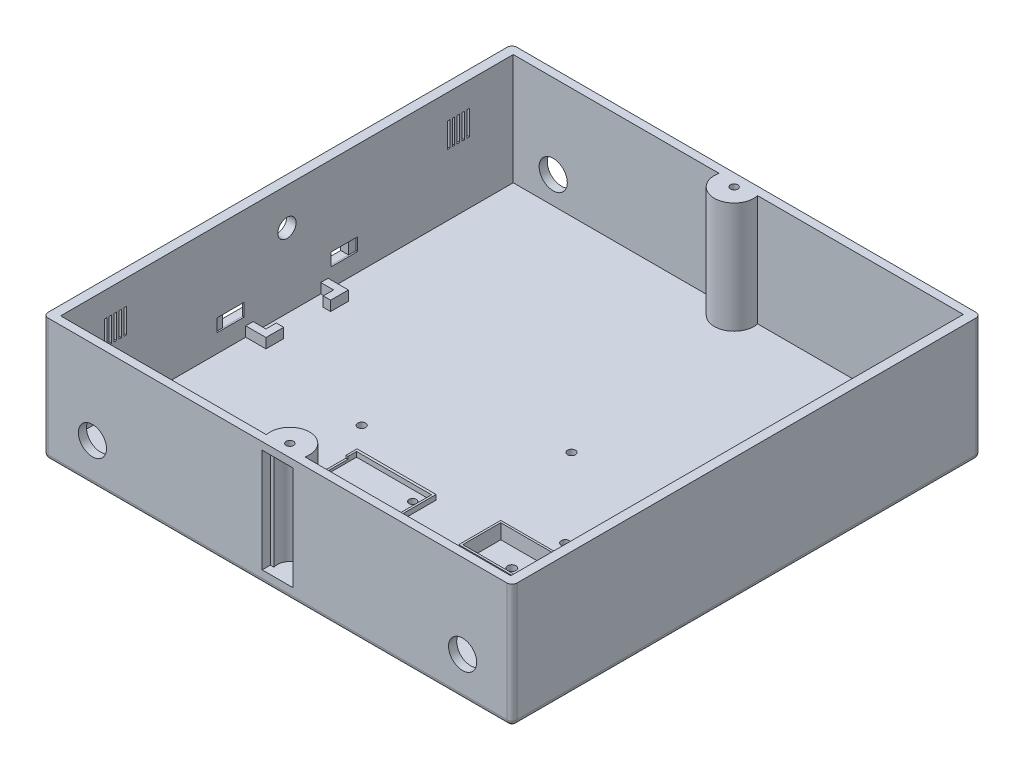
from build123d import *

# Parameters (mm, degrees)
SKETCH2_W            = 190
SKETCH2_H            = 190
BOSS_EXTRUDE1_DEPTH  = 5
SKETCH4_W            = 6
SKETCH4_H            = 6
BOSS_EXTRUDE2_DEPTH  = 3
SKETCH7_R            = 2.799999999
BOSS_EXTRUDE5_DEPTH  = 6
BOSS_EXTRUDE10_DEPTH = 45
BOSS_EXTRUDE6_DEPTH  = 6
BOSS_EXTRUDE7_DEPTH  = 6
CUT_EXTRUDE6_DEPTH   = 6
BOSS_EXTRUDE8_DEPTH  = 6
SKETCH15_R           = 1.7
CUT_EXTRUDE7_DEPTH   = 25
SKETCH16_W           = 32
SKETCH16_H           = 24
SKETCH16_W_2         = 30.4
SKETCH16_H_2         = 22.171363073
BOSS_EXTRUDE9_DEPTH  = 2
SKETCH17_W           = 15
SKETCH17_H           = 1
CUT_EXTRUDE8_DEPTH   = 1.2
SKETCH18_R           = 1.5
CUT_EXTRUDE9_DEPTH   = 12
CUT_EXTRUDE11_DEPTH  = 15
SKETCH22_R           = 5.7
CUT_EXTRUDE12_DEPTH  = 15
SKETCH23_R           = 5.7
CUT_EXTRUDE13_DEPTH  = 15
SKETCH26_R           = 3.7
CUT_EXTRUDE14_DEPTH  = 15
BOSS_EXTRUDE13_DEPTH = 4
SKETCH39_R           = 8
SKETCH39_R_2         = 1.5
BOSS_EXTRUDE21_DEPTH = 45
CUT_EXTRUDE43_DEPTH  = 42
CUT_EXTRUDE47_DEPTH  = 42
SKETCH45_R           = 8
SKETCH45_R_2         = 1.5
BOSS_EXTRUDE22_DEPTH = 45
CUT_EXTRUDE48_DEPTH  = 42
CUT_EXTRUDE49_DEPTH  = 42
BOSS_EXTRUDE23_DEPTH = 45
SKETCH49_R           = 1.00126639
SKETCH49_R_2         = 1
CUT_EXTRUDE50_DEPTH  = 45
FILLET2_R            = 2
SKETCH51_R           = 1.608
CUT_EXTRUDE51_DEPTH  = 45
SKETCH52_W           = 1
SKETCH52_H           = 10
CUT_EXTRUDE53_DEPTH  = 45
SKETCH53_W           = 51.2
SKETCH53_H           = 5.2
CUT_EXTRUDE54_DEPTH  = 3.2
SKETCH55_W           = 7.803577565
SKETCH55_H           = 5.19826713
SKETCH55_W_2         = 8
CUT_EXTRUDE55_DEPTH  = 3.2
SKETCH56_W           = 3
SKETCH56_H           = 5.19826713
CUT_EXTRUDE56_DEPTH  = 0.6
CUT_EXTRUDE57_START  = -5
CUT_EXTRUDE57_DEPTH  = 5


with BuildPart() as part:
    # Sketch2 → Boss-Extrude1 (new body)
    with BuildSketch(Plane(origin=(0, 0, 0), x_dir=(1, 0, 0), z_dir=(0, 1, 0))):
        with Locations((317.995760734, 126.549729936)):
            Rectangle(SKETCH2_W, SKETCH2_H)
    extrude(amount=BOSS_EXTRUDE1_DEPTH)

    # Sketch4 → Boss-Extrude2 (add)
    with BuildSketch(Plane(origin=(0, 5, 0), x_dir=(1, 0, 0), z_dir=(0, 1, 0))):
        with Locations((383.22341631, 141.294689712)):
            Rectangle(SKETCH4_W, SKETCH4_H)
        with Locations((397.22341631, 141.294689712)):
            Rectangle(SKETCH4_W, SKETCH4_H)
        with Locations((383.22341631, 175.294689712)):
            Rectangle(SKETCH4_W, SKETCH4_H)
        with Locations((397.22341631, 175.294689712)):
            Rectangle(SKETCH4_W, SKETCH4_H)
    extrude(amount=BOSS_EXTRUDE2_DEPTH)

    # Sketch7 → Boss-Extrude5 (add)
    with BuildSketch(Plane(origin=(0, 5, 0), x_dir=(1, 0, 0), z_dir=(0, 1, 0))):
        with BuildLine():
            Line((401.22341631, 137.294689712), (401.22341631, 146.003401864))
            ThreePointArc((401.22341631, 146.003401864), (402.72341631, 148.294689712), (401.22341631, 150.585977559))
            Line((401.22341631, 150.585977559), (401.22341631, 165.466262588))
            ThreePointArc((401.22341631, 165.466262588), (400.829054735, 165.356458596), (400.42341631, 165.301363803))
            Line((400.42341631, 165.301363803), (400.42341631, 149.982884013))
            ThreePointArc((400.42341631, 149.982884013), (401.92341631, 148.294689711), (400.42341631, 146.60649541))
            Line((400.42341631, 146.60649541), (400.42341631, 138.094689712))
            Line((400.42341631, 138.094689712), (380.02341631, 138.094689712))
            Line((380.02341631, 138.094689712), (380.02341631, 146.60649541))
            ThreePointArc((380.02341631, 146.60649541), (378.52341631, 148.294689711), (380.023416309, 149.982884013))
            Line((380.023416309, 149.982884013), (380.023416309, 165.301363803))
            ThreePointArc((380.023416309, 165.301363801), (379.617777883, 165.356458594), (379.223416309, 165.466262586))
            Line((379.22341631, 165.466262588), (379.22341631, 150.585977559))
            ThreePointArc((379.22341631, 150.585977559), (377.72341631, 148.294689712), (379.22341631, 146.003401864))
            Line((379.22341631, 146.003401864), (379.22341631, 137.294689712))
            Line((379.22341631, 137.294689712), (401.22341631, 137.294689712))
        make_face()
        with Locations((380.223416309, 168.294689712)):
            Circle(SKETCH7_R)
        with BuildLine():
            ThreePointArc((379.223416309, 171.123116838), (379.617777883, 171.23292083), (380.023416309, 171.288015622))
            Line((380.023416309, 171.28801562), (380.023416309, 178.494689712))
            Line((380.023416309, 178.494689712), (388.535222008, 178.494689712))
            ThreePointArc((388.535222008, 178.494689712), (390.22341631, 179.994689712), (391.911610611, 178.494689712))
            Line((391.911610611, 178.494689712), (400.42341631, 178.494689712))
            Line((400.42341631, 178.494689712), (400.42341631, 171.28801562))
            ThreePointArc((400.42341631, 171.28801562), (400.829054735, 171.232920828), (401.22341631, 171.123116836))
            Line((401.22341631, 171.123116836), (401.22341631, 179.294689712))
            Line((401.22341631, 179.294689712), (392.514704157, 179.294689712))
            ThreePointArc((392.514704157, 179.294689712), (390.22341631, 180.794689712), (387.932128462, 179.294689712))
            Line((387.932128462, 179.294689712), (379.22341631, 179.294689712))
            Line((379.22341631, 179.294689712), (379.22341631, 171.123116836))
        make_face()
        with Locations((400.223416311, 168.294689712)):
            Circle(SKETCH7_R)
    extrude(amount=BOSS_EXTRUDE5_DEPTH)

    # Sketch20 → Boss-Extrude10 (add)
    with BuildSketch(Plane(origin=(0, 5, 0), x_dir=(1, 0, 0), z_dir=(0, 1, 0))):
        with BuildLine():
            Line((222.995760734, 31.549729936), (412.995760734, 31.549729936))
            Line((412.995760734, 31.549729936), (412.995760736, 120.304731936))
            ThreePointArc((412.995760735, 120.304731937), (411.205532023, 119.221881119), (409.195760736, 118.640241963))
            Line((409.195760736, 118.640241963), (409.195760736, 34.849729938))
            Line((409.195760736, 34.849729938), (226.795760733, 34.849729938))
            Line((226.795760733, 34.849729938), (226.795760733, 118.640241963))
            Line((226.795760733, 118.640241963), (226.795760733, 134.459217909))
            Line((226.795760733, 134.459217909), (226.795760733, 218.249729938))
            Line((226.795760733, 218.249729938), (409.189482406, 218.249729938))
            Line((409.189482406, 218.249729938), (409.189482406, 134.460167887))
            ThreePointArc((409.189482406, 134.460167887), (411.202623624, 133.878852013), (412.995760734, 132.794727937))
            Line((412.995760734, 132.794727937), (412.995760734, 221.549729936))
            Line((412.995760734, 221.549729936), (222.995760734, 221.549729936))
            Line((222.995760734, 221.549729936), (222.995760733, 132.794727937))
            Line((222.995760734, 132.794727937), (222.995760734, 120.304731936))
            Line((222.995760733, 120.304731936), (222.995760734, 31.549729936))
        make_face()
    extrude(amount=BOSS_EXTRUDE10_DEPTH)

    # Sketch10 → Boss-Extrude6 (add)
    with BuildSketch(Plane(origin=(0, 5, 0), x_dir=(1, 0, 0), z_dir=(0, 1, 0))):
        Polygon((400.42341631, 171.28801562), (400.42341631, 165.301363803), (401.22341631, 165.301363803), (401.22341631, 171.337887446), (400.42341631, 171.337887446), align=None)
    extrude(amount=BOSS_EXTRUDE6_DEPTH)

    # Sketch11 → Boss-Extrude7 (add)
    with BuildSketch(Plane(origin=(0, 5, 0), x_dir=(1, 0, 0), z_dir=(0, 1, 0))):
        Polygon((379.22341631, 171.123116836), (379.22341631, 165.091930174), (380.023416309, 165.091930174), (380.023416309, 171.603611758), (379.22341631, 171.603611758), align=None)
    extrude(amount=BOSS_EXTRUDE7_DEPTH)

    # Sketch13 → Cut-Extrude6 (cut)
    with BuildSketch(Plane(origin=(0, 5, 0), x_dir=(1, 0, 0), z_dir=(0, 1, 0))):
        with BuildLine():
            Line((379.22341631, 165.679350346), (379.22341631, 170.910029077))
            ThreePointArc((379.22341631, 170.910029077), (377.42341631, 168.294689712), (379.22341631, 165.679350346))
        make_face()
    extrude(amount=CUT_EXTRUDE6_DEPTH, mode=Mode.SUBTRACT)

    # Sketch14 → Boss-Extrude8 (add)
    with BuildSketch(Plane(origin=(0, 5, 0), x_dir=(1, 0, 0), z_dir=(0, 1, 0))):
        with BuildLine():
            Line((348.748945699, 90.441877285), (348.748945699, 74.241877285))
            Line((348.748945699, 74.241877285), (383.07719417, 74.241877285))
            ThreePointArc((383.07719417, 74.241877285), (400.548884842, 82.723130909), (383.095443972, 91.241877285))
            Line((383.095443972, 91.241877285), (348.748945699, 91.241877285))
            Line((348.748945699, 91.241877285), (348.748945699, 90.441877285))
        make_face()
        with BuildLine():
            Line((349.548945699, 75.041877285), (349.548945699, 90.441877285))
            Line((349.548945699, 90.441877285), (383.067588644, 90.441877285))
            ThreePointArc((383.067588644, 90.441877285), (399.948885235, 82.723819155), (383.051123105, 75.041877285))
            Line((383.051123105, 75.041877285), (349.548945699, 75.041877285))
        make_face(mode=Mode.SUBTRACT)
    extrude(amount=BOSS_EXTRUDE8_DEPTH)

    # Sketch15 → Cut-Extrude7 (cut)
    with BuildSketch(Plane(origin=(0, 5, 0), x_dir=(1, 0, 0), z_dir=(0, 1, 0))):
        with Locations((361.748945699, 82.734724895)):
            Circle(SKETCH15_R)
    extrude(amount=-CUT_EXTRUDE7_DEPTH, mode=Mode.SUBTRACT)

    # Sketch16 → Boss-Extrude9 (add)
    with BuildSketch(Plane(origin=(0, 5, 0), x_dir=(1, 0, 0), z_dir=(0, 1, 0))):
        with Locations((306.534634956, 79.241877285)):
            Rectangle(SKETCH16_W, SKETCH16_H)
        with Locations((306.534634956, 79.127558822)):
            Rectangle(SKETCH16_W_2, SKETCH16_H_2, mode=Mode.SUBTRACT)
    extrude(amount=BOSS_EXTRUDE9_DEPTH)

    # Sketch17 → Cut-Extrude8 (cut)
    with BuildSketch(Plane.ZY.offset(-290.534634956)):
        with Locations((-79.241877285, 6.5)):
            Rectangle(SKETCH17_W, SKETCH17_H)
    extrude(amount=-CUT_EXTRUDE8_DEPTH, mode=Mode.SUBTRACT)

    # Sketch18 → Cut-Extrude9 (cut)
    with BuildSketch(Plane(origin=(0, 5, 0), x_dir=(1, 0, 0), z_dir=(0, 1, 0))):
        with Locations((318.237299978, 71.546782116)):
            Circle(SKETCH18_R)
        with Locations((318.237299978, 86.021279159)):
            Circle(SKETCH18_R)
    extrude(amount=-CUT_EXTRUDE9_DEPTH, mode=Mode.SUBTRACT)

    # Sketch21 → Cut-Extrude11 (cut)
    with BuildSketch(Plane(origin=(0, 5, 0), x_dir=(1, 0, 0), z_dir=(0, 1, 0))):
        with BuildLine():
            ThreePointArc((401.22341631, 165.679350346), (403.02341631, 168.294689712), (401.22341631, 170.910029077))
            Line((401.22341631, 170.910029077), (401.22341631, 165.679350346))
        make_face()
    extrude(amount=CUT_EXTRUDE11_DEPTH, mode=Mode.SUBTRACT)

    # Sketch22 → Cut-Extrude12 (cut)
    with BuildSketch(Plane(origin=(0, 0, -221.549729936), x_dir=(-1, 0, 0), z_dir=(0, 0, -1))):
        with Locations((-242.995760734, 15.970492544)):
            Circle(SKETCH22_R)
        with Locations((-392.995760734, 15.970492544)):
            Circle(SKETCH22_R)
    extrude(amount=-CUT_EXTRUDE12_DEPTH, mode=Mode.SUBTRACT)

    # Sketch23 → Cut-Extrude13 (cut)
    with BuildSketch(Plane.XY.offset(-31.549729936)):
        with Locations((392.987274742, 15.972381323)):
            Circle(SKETCH23_R)
        with Locations((242.987274742, 15.972381323)):
            Circle(SKETCH23_R)
    extrude(amount=-CUT_EXTRUDE13_DEPTH, mode=Mode.SUBTRACT)

    # Sketch26 → Cut-Extrude14 (cut)
    with BuildSketch(Plane.ZY.offset(-222.995760734)):
        with Locations((-126.549729936, 35)):
            Circle(SKETCH26_R)
    extrude(amount=-CUT_EXTRUDE14_DEPTH, mode=Mode.SUBTRACT)

    # Sketch24 → Boss-Extrude13 (add)
    with BuildSketch(Plane(origin=(0, 5, 0), x_dir=(1, 0, 0), z_dir=(0, 1, 0))):
        Polygon((226.802039063, 143.247259128), (226.802039063, 140.249729936), (231.995760733, 140.249729936), (231.995760733, 136.049729936), (234.995760733, 136.049729936), (234.995760733, 143.247259128), align=None)
        Polygon((231.995760733, 117.049729936), (231.995760733, 112.849729936), (226.802039063, 112.849729936), (226.802039063, 109.849729936), (234.995760733, 109.849729936), (234.995760733, 117.049729936), align=None)
    extrude(amount=BOSS_EXTRUDE13_DEPTH)

    # Sketch39 → Boss-Extrude21 (add)
    with BuildSketch(Plane(origin=(0, 5, 0), x_dir=(1, 0, 0), z_dir=(0, 1, 0))):
        with Locations((317.995760735, 216.549729936)):
            Circle(SKETCH39_R)
        with Locations((317.995760735, 216.549729936)):
            Circle(SKETCH39_R_2, mode=Mode.SUBTRACT)
    extrude(amount=BOSS_EXTRUDE21_DEPTH)

    # Sketch41 → Cut-Extrude43 (cut)
    with BuildSketch(Plane(origin=(0, 5, 0), x_dir=(1, 0, 0), z_dir=(0, 1, 0))):
        with BuildLine():
            ThreePointArc((324.240758735, 221.549729933), (317.995760735, 224.549729936), (311.750762734, 221.549729933))
            Line((311.750762734, 221.549729933), (317.995760735, 221.549729933))
            Line((317.995760735, 221.549729933), (324.240758735, 221.549729933))
        make_face()
    extrude(amount=CUT_EXTRUDE43_DEPTH, mode=Mode.SUBTRACT)

    # Sketch42 → Cut-Extrude47 (cut)
    with BuildSketch(Plane(origin=(0, 5, 0), x_dir=(1, 0, 0), z_dir=(0, 1, 0))):
        with BuildLine():
            Line((311.750762736, 221.549729936), (311.750762736, 218.26387511))
            Line((311.750762736, 218.26387511), (313.298771665, 218.26387511))
            ThreePointArc((313.298771665, 218.26387511), (317.988236008, 211.549735598), (322.697887912, 218.249729938))
            Line((322.697887912, 218.249729938), (324.25546859, 218.249729938))
            Line((324.25546859, 218.249729938), (324.240758733, 221.549729936))
            Line((324.240758733, 221.549729936), (323.695017468, 221.549729936))
            Line((323.695017468, 221.549729936), (311.750762736, 221.549729936))
        make_face()
    extrude(amount=CUT_EXTRUDE47_DEPTH, mode=Mode.SUBTRACT)

    # Sketch45 → Boss-Extrude22 (add)
    with BuildSketch(Plane(origin=(0, 5, 0), x_dir=(1, 0, 0), z_dir=(0, 1, 0))):
        with Locations((317.995760735, 36.549729936)):
            Circle(SKETCH45_R)
        with Locations((317.995760735, 36.549729936)):
            Circle(SKETCH45_R_2, mode=Mode.SUBTRACT)
    extrude(amount=BOSS_EXTRUDE22_DEPTH)

    # Sketch46 → Cut-Extrude48 (cut)
    with BuildSketch(Plane(origin=(0, 5, 0), x_dir=(1, 0, 0), z_dir=(0, 1, 0))):
        with BuildLine():
            Line((324.240758733, 31.549729936), (317.995760735, 31.549729936))
            Line((317.995760735, 31.549729936), (311.750762736, 31.549729936))
            ThreePointArc((311.750762736, 31.549729936), (317.995760735, 28.549729936), (324.240758733, 31.549729936))
        make_face()
    extrude(amount=CUT_EXTRUDE48_DEPTH, mode=Mode.SUBTRACT)

    # Sketch47 → Cut-Extrude49 (cut)
    with BuildSketch(Plane(origin=(0, 5, 0), x_dir=(1, 0, 0), z_dir=(0, 1, 0))):
        with BuildLine():
            Line((313.293633557, 34.849729934), (311.750762734, 34.849729934))
            Line((311.750762734, 34.849729934), (311.750762734, 31.549729939))
            Line((311.750762734, 31.549729939), (317.995760735, 31.549729939))
            Line((317.995760735, 31.549729939), (324.240758735, 31.549729939))
            Line((324.240758735, 31.549729939), (324.240758735, 34.849729934))
            Line((324.240758735, 34.849729934), (322.697887912, 34.849729934))
            ThreePointArc((322.697887912, 34.849729934), (317.995760735, 41.549729936), (313.293633557, 34.849729934))
        make_face()
    extrude(amount=CUT_EXTRUDE49_DEPTH, mode=Mode.SUBTRACT)

    # Sketch48 → Boss-Extrude23 (add)
    with BuildSketch(Plane(origin=(0, 5, 0), x_dir=(1, 0, 0), z_dir=(0, 1, 0))):
        Polygon((409.189482406, 134.460167887), (409.195760736, 118.640241963), (412.995760736, 118.640241963), (412.995760736, 134.460167887), align=None)
    extrude(amount=BOSS_EXTRUDE23_DEPTH)

    # Sketch49 → Cut-Extrude50 (cut)
    with BuildSketch(Plane(origin=(0, 5, 0), x_dir=(1, 0, 0), z_dir=(0, 1, 0))):
        with Locations((400.223416309, 148.294689712)):
            Circle(SKETCH49_R)
        with Locations((380.223416309, 148.294689712)):
            Circle(SKETCH49_R_2)
        with Locations((390.223416309, 178.294689712)):
            Circle(SKETCH49_R_2)
    extrude(amount=-CUT_EXTRUDE50_DEPTH, mode=Mode.SUBTRACT)

    # Fillet2
    fillet2_edges = [part.edges().sort_by_distance(p)[0] for p in [
        (412.995760734, 0, -126.549729936),
        (317.995760734, 0, -31.549729936),
        (222.995760734, 0, -126.549729936),
        (317.995760734, 0, -221.549729936),
        (222.995760734, 27.5, -221.549729936),
        (412.995760734, 25, -221.549729936),
        (412.995760734, 27.5, -31.549729936),
        (222.995760734, 27.5, -31.549729936),
    ]]
    fillet(fillet2_edges, radius=FILLET2_R)

    # Sketch51 → Cut-Extrude51 (cut)
    with BuildSketch(Plane(origin=(0, 5, 0), x_dir=(1, 0, 0), z_dir=(0, 1, 0))):
        with Locations((281.200760735, 102.438729936)):
            Circle(SKETCH51_R)
        with Locations((363.679760735, 102.438729936)):
            Circle(SKETCH51_R)
        with Locations((333.231760735, 135.425729936)):
            Circle(SKETCH51_R)
    extrude(amount=-CUT_EXTRUDE51_DEPTH, mode=Mode.SUBTRACT)

    # Sketch52 → Cut-Extrude53 (cut)
    with BuildSketch(Plane.ZY.offset(-222.995760734)):
        with Locations((-200.049729936, 35)):
            Rectangle(SKETCH52_W, SKETCH52_H)
        with Locations((-198.049729936, 35)):
            Rectangle(SKETCH52_W, SKETCH52_H)
        with Locations((-196.049729936, 35)):
            Rectangle(SKETCH52_W, SKETCH52_H)
        with Locations((-194.049729936, 35)):
            Rectangle(SKETCH52_W, SKETCH52_H)
        with Locations((-192.049729936, 35)):
            Rectangle(SKETCH52_W, SKETCH52_H)
        with Locations((-53.049729936, 35)):
            Rectangle(SKETCH52_W, SKETCH52_H)
        with Locations((-55.049729936, 35)):
            Rectangle(SKETCH52_W, SKETCH52_H)
        with Locations((-57.049729936, 35)):
            Rectangle(SKETCH52_W, SKETCH52_H)
        with Locations((-59.049729936, 35)):
            Rectangle(SKETCH52_W, SKETCH52_H)
        with Locations((-61.049729936, 35)):
            Rectangle(SKETCH52_W, SKETCH52_H)
    extrude(amount=-CUT_EXTRUDE53_DEPTH, mode=Mode.SUBTRACT)

    # Sketch53 → Cut-Extrude54 (cut)
    with BuildSketch(Plane.ZY.offset(-222.995760734)):
        with Locations((-126.549729936, 15)):
            Rectangle(SKETCH53_W, SKETCH53_H)
    extrude(amount=-CUT_EXTRUDE54_DEPTH, mode=Mode.SUBTRACT)

    # Sketch55 → Cut-Extrude55 (cut)
    with BuildSketch(Plane.ZY.offset(-226.195760734)):
        with Locations((-148.247941153, 15.000866435)):
            Rectangle(SKETCH55_W, SKETCH55_H)
        with Locations((-105.146152371, 15.000866435)):
            Rectangle(SKETCH55_W_2, SKETCH55_H)
    extrude(amount=-CUT_EXTRUDE55_DEPTH, mode=Mode.SUBTRACT)

    # Sketch56 → Cut-Extrude56 (cut)
    with BuildSketch(Plane(origin=(226.795760733, 0, 0), x_dir=(0, 0, -1), z_dir=(1, 0, 0))):
        with Locations((99.646152371, 15.000866435)):
            Rectangle(SKETCH56_W, SKETCH56_H)
        with Locations((153.649729936, 15.000866435)):
            Rectangle(SKETCH56_W, SKETCH56_H)
    extrude(amount=-CUT_EXTRUDE56_DEPTH, mode=Mode.SUBTRACT)

    # Sketch57 → Cut-Extrude57 (cut)
    with BuildSketch(Plane(origin=(0, 50, 0), x_dir=(1, 0, 0), z_dir=(0, 1, 0)).offset(CUT_EXTRUDE57_START)):
        with BuildLine():
            Line((311.750762736, 31.549729936), (324.240758733, 31.549729936))
            ThreePointArc((324.240758733, 31.549729936), (317.995760735, 28.549729936), (311.750762736, 31.549729936))
        make_face()
        with BuildLine():
            Line((311.750762736, 221.549729936), (324.240758733, 221.549729936))
            ThreePointArc((324.240758733, 221.549729936), (317.995760735, 224.549729936), (311.750762736, 221.549729936))
        make_face()
    extrude(amount=CUT_EXTRUDE57_DEPTH, mode=Mode.SUBTRACT)


solid = part.part
